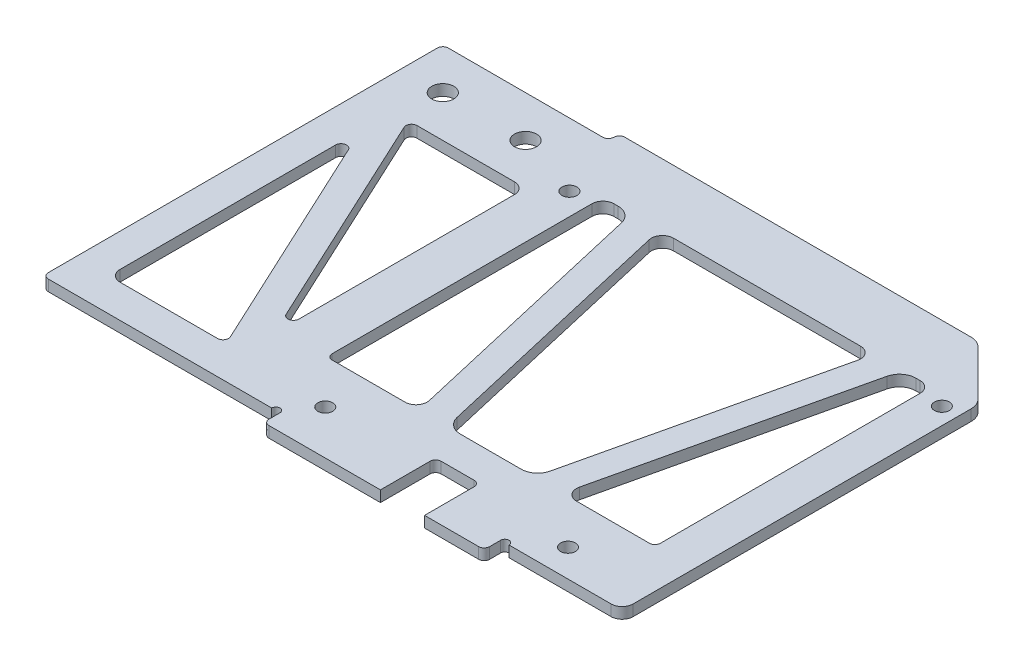
from build123d import *

# Parameters (mm, degrees)
SKETCH_1_R          = 2
EXTRUDE_1_DEPTH     = 2
SKETCH_4_R          = 1.35
SKETCH_4_W          = 8
SKETCH_4_H          = 10
CUT_EXTRUDE_2_DEPTH = 130.341601969
SKETCH_2_R          = 0.75
SKETCH_2_W          = 24
SKETCH_2_H          = 51.5
SKETCH_2_W_2        = 59.5
SKETCH_2_H_2        = 50.064718626
CUT_EXTRUDE_1_DEPTH = 130.341601969
EXTRUDE_1_2_DEPTH   = 2
FILLET_1_R          = 1
FILLET_3_R          = 3
FILLET_2_R          = 2


with BuildPart() as part:
    # 草图1 → Extrude 1 (new body)
    with BuildSketch(Plane(origin=(0, 0, 0), x_dir=(1, 0, 0), z_dir=(0, 1, 0))):
        Polygon((0, 0), (30, 0), (30, 2), (95, 2), (105, -8), (105, -72.5), (83, -72.5), (83, -75.5), (43, -75.5), (43, -72.5), (0, -72.5), align=None)
        with Locations(Location((7.5, -7.5, 0), (0, 0, 270))):
            Circle(SKETCH_1_R, mode=Mode.SUBTRACT)
        with Locations(Location((22.5, -7.5, 0), (0, 0, 270))):
            Circle(SKETCH_1_R, mode=Mode.SUBTRACT)
    extrude(amount=EXTRUDE_1_DEPTH)

    # 草图4 → 切除-拉伸2 (cut, through all)
    with BuildSketch(Plane(origin=(0, 2, 0), x_dir=(1, 0, 0), z_dir=(0, 1, 0))):
        with Locations(Location((34.45, -11.5, 0), (0, 0, 270))):
            Circle(SKETCH_4_R)
        with Locations(Location((46.2, -67.5, 0), (0, 0, 270))):
            Circle(SKETCH_4_R)
        with Locations(Location((90.2, -67.5, 0), (0, 0, 90))):
            Circle(SKETCH_4_R)
        with Locations(Location((101.95, -11.5, 0), (0, 0, 90))):
            Circle(SKETCH_4_R)
        with Locations((68.2, -70.5)):
            Rectangle(SKETCH_4_W, SKETCH_4_H)
    extrude(amount=-CUT_EXTRUDE_2_DEPTH, mode=Mode.SUBTRACT)

    # 草图2 → 切除-拉伸1 (cut, through all)
    with BuildSketch(Plane(origin=(0, 2, 0), x_dir=(1, 0, 0), z_dir=(0, 1, 0))):
        with Locations((83.75, -72.5)):
            Circle(SKETCH_2_R)
        with Locations((42.25, -72.5)):
            Circle(SKETCH_2_R)
        with Locations((18, -40.75)):
            Rectangle(SKETCH_2_W, SKETCH_2_H)
        with Locations((68.2, -34.467640687)):
            Rectangle(SKETCH_2_W_2, SKETCH_2_H_2)
    extrude(amount=-CUT_EXTRUDE_1_DEPTH, mode=Mode.SUBTRACT)

    # 草图3 → Extrude 1 2 (add)
    with BuildSketch(Plane(origin=(0, 2, 0), x_dir=(1, 0, 0), z_dir=(0, 1, 0))):
        Polygon((3.733980422, -16.056009124), (27.733980422, -67.556009124), (32.266019578, -65.443990876), (8.266019578, -13.943990876), align=None)
        Polygon((43.264254449, -7.998436425), (55.764254449, -62.063155051), (60.635745551, -60.936844949), (48.135745551, -6.872126323), align=None)
        Polygon((88.264254449, -6.872126323), (75.764254449, -60.936844949), (80.635745551, -62.063155051), (93.135745551, -7.998436425), align=None)
    extrude(amount=-EXTRUDE_1_2_DEPTH)

    # 圆角1
    fillet_1_edges = [part.edges().sort_by_distance(p)[0] for p in [
        (27.241859665, 1, 66.5),
        (30, 1, 60.581490531),
        (8.758140335, 1, 15),
        (6, 1, 20.918509469),
        (0, 1, 0),
        (30, 1, 0),
        (30, 1, -2),
        (83, 1, 75.5),
        (43, 1, 75.5),
        (0, 1, 72.5),
        (64.2, 1, 65.5),
        (72.2, 1, 65.5),
        (38.45, 1, 59.5),
        (97.95, 1, 59.5),
    ]]
    fillet(fillet_1_edges, radius=FILLET_1_R - 0.0001)  # a hair under: the kernel refuses the full size

    # 圆角3
    fillet_3_edges = [part.edges().sort_by_distance(p)[0] for p in [
        (60.303540699, 1, 59.5),
        (43.596459301, 1, 9.435281374),
        (95, 1, -2),
        (105, 1, 8),
        (92.803540699, 1, 9.435281374),
        (76.096459301, 1, 59.5),
    ]]
    fillet(fillet_3_edges, radius=FILLET_3_R)

    # 圆角2
    fillet_2_edges = [part.edges().sort_by_distance(p)[0] for p in [
        (55.171641763, 1, 59.5),
        (48.728358237, 1, 9.435281374),
        (105, 1, 72.5),
        (81.228358237, 1, 59.5),
        (87.671641763, 1, 9.435281374),
        (6, 1, 66.5),
        (30, 1, 15),
        (38.45, 1, 9.435281374),
        (97.95, 1, 9.435281374),
    ]]
    fillet(fillet_2_edges, radius=FILLET_2_R)


solid = part.part
